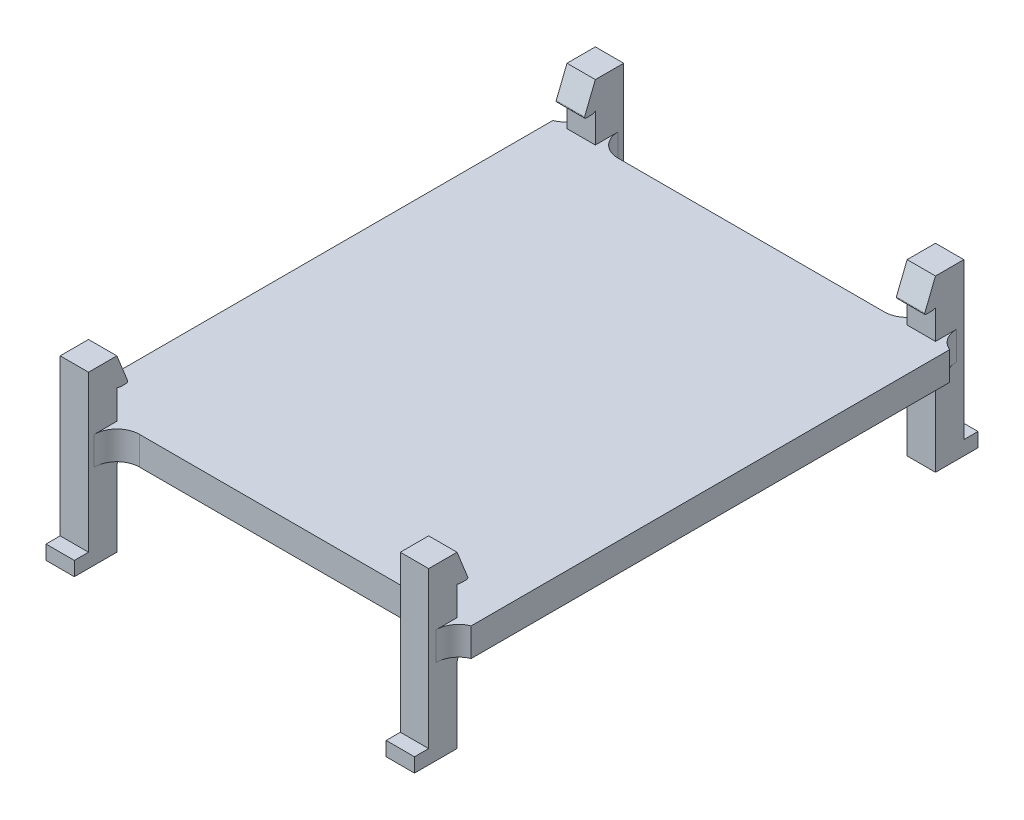
from build123d import *

# Parameters (mm, degrees)
SKETCH1_W           = 44.45
SKETCH1_H           = 53.594
BOSS_EXTRUDE1_DEPTH = 3.175
SKETCH2_W           = 3.175
SKETCH2_H           = 19.05
BOSS_EXTRUDE2_DEPTH = 3.175
SKETCH4_W           = 3.175
SKETCH4_H           = 19.05
BOSS_EXTRUDE3_DEPTH = 3.175
BOSS_EXTRUDE4_DEPTH = 3.175
BOSS_EXTRUDE5_DEPTH = 3.175
SKETCH11_W          = 3.175
SKETCH11_H          = 1.5875
BOSS_EXTRUDE6_DEPTH = 1.5875
SKETCH12_W          = 3.175
SKETCH12_H          = 1.5875
BOSS_EXTRUDE7_DEPTH = 1.5875
FILLET1_R           = 2.54
FILLET2_R           = 0.127
FILLET3_R           = 1.27


with BuildPart() as part:
    # Sketch1 → Boss-Extrude1 (new body)
    with BuildSketch(Plane(origin=(0, 0, 0), x_dir=(1, 0, 0), z_dir=(0, 1, 0))):
        with Locations((20.14322973, 10.682587838)):
            Rectangle(SKETCH1_W, SKETCH1_H)
    extrude(amount=BOSS_EXTRUDE1_DEPTH)

    # Sketch2 → Boss-Extrude2 (add)
    with BuildSketch(Plane.XY.offset(16.114412162)):
        with Locations((1.09322973, 0)):
            Rectangle(SKETCH2_W, SKETCH2_H)
        with Locations((39.19322973, 0)):
            Rectangle(SKETCH2_W, SKETCH2_H)
    extrude(amount=BOSS_EXTRUDE2_DEPTH)

    # Sketch4 → Boss-Extrude3 (add)
    with BuildSketch(Plane(origin=(0, 0, -37.479587838), x_dir=(-1, 0, 0), z_dir=(0, 0, -1))):
        with Locations((-1.09322973, 0)):
            Rectangle(SKETCH4_W, SKETCH4_H)
        with Locations((-39.19322973, 0)):
            Rectangle(SKETCH4_W, SKETCH4_H)
    extrude(amount=BOSS_EXTRUDE3_DEPTH)

    # Sketch9 → Boss-Extrude4 (add)
    with BuildSketch(Plane(origin=(40.78072973, 0, 0), x_dir=(0, 0, -1), z_dir=(1, 0, 0))):
        with BuildLine():
            Line((-16.114412162, 9.525), (-14.844412162, 6.35))
            add(Edge.make_bspline(
                [(-14.844412162, 6.35), (-15.980974803, 6.259875381), (-16.114412162, 6.477)],
                knots=[0, 0, 0, 1, 1, 1], degree=2))
            Line((-16.114412162, 6.477), (-16.114412162, 9.525))
        make_face()
        with BuildLine():
            Line((37.479587838, 9.525), (36.209587838, 6.35))
            add(Edge.make_bspline(
                [(36.209587838, 6.35), (37.346150478, 6.259875381), (37.479587838, 6.477)],
                knots=[0, 0, 0, 1, 1, 1], degree=2))
            Line((37.479587838, 6.477), (37.479587838, 9.525))
        make_face()
    extrude(amount=-BOSS_EXTRUDE4_DEPTH)

    # Sketch10 → Boss-Extrude5 (add)
    with BuildSketch(Plane.ZY.offset(0.49427027)):
        with BuildLine():
            Line((-37.479587838, 9.525), (-36.209587838, 6.35))
            add(Edge.make_bspline(
                [(-36.209587838, 6.35), (-37.253478126, 6.221904512), (-37.479587838, 6.477)],
                knots=[0, 0, 0, 1, 1, 1], degree=2))
            Line((-37.479587838, 6.477), (-37.479587838, 9.525))
        make_face()
        with BuildLine():
            Line((16.114412162, 9.525), (14.844412162, 6.35))
            add(Edge.make_bspline(
                [(14.844412162, 6.35), (15.88830245, 6.221904512), (16.114412162, 6.477)],
                knots=[0, 0, 0, 1, 1, 1], degree=2))
            Line((16.114412162, 6.477), (16.114412162, 9.525))
        make_face()
    extrude(amount=-BOSS_EXTRUDE5_DEPTH)

    # Sketch11 → Boss-Extrude6 (add)
    with BuildSketch(Plane.XY.offset(19.289412162)):
        with Locations((1.09322973, -8.73125)):
            Rectangle(SKETCH11_W, SKETCH11_H)
        with Locations((39.19322973, -8.73125)):
            Rectangle(SKETCH11_W, SKETCH11_H)
    extrude(amount=BOSS_EXTRUDE6_DEPTH)

    # Sketch12 → Boss-Extrude7 (add)
    with BuildSketch(Plane(origin=(0, 0, -40.654587838), x_dir=(-1, 0, 0), z_dir=(0, 0, -1))):
        with Locations((-39.19322973, -8.73125)):
            Rectangle(SKETCH12_W, SKETCH12_H)
        with Locations((-1.09322973, -8.73125)):
            Rectangle(SKETCH12_W, SKETCH12_H)
    extrude(amount=BOSS_EXTRUDE7_DEPTH)

    # Fillet1
    # the kernel refuses this fillet: 2.54 mm, written as the material it adds along each edge
    with BuildSketch(Plane(origin=(37.60572973, 0, 16.114412162), x_dir=(0, 0, 1), z_dir=(0, 1, 0)), Plane(origin=(2.68072973, 0, -37.479587838), x_dir=(0, 0, -1), z_dir=(0, 1, 0))) as fillet1_piece_1:
        with BuildLine():
            CenterArc((FILLET1_R, -FILLET1_R), FILLET1_R, 90, 90)
            Line((0, -FILLET1_R), (0, 0))
            Line((0, 0), (FILLET1_R, 0))
        make_face()
    extrude(amount=3.175)
    with BuildSketch(Plane(origin=(40.78072973, 3.175, 16.114412162), x_dir=(1, 0, 0), z_dir=(0, -1, 0)), Plane(origin=(-0.49427027, 0, 16.114412162), x_dir=(-1, 0, 0), z_dir=(0, 1, 0)), Plane(origin=(-0.49427027, 3.175, -37.479587838), x_dir=(-1, 0, 0), z_dir=(0, -1, 0))) as fillet1_piece_2:
        with BuildLine():
            CenterArc((2.54, 2.35464302), FILLET1_R, 180, 67.975687163)
            Line((0, 2.35464302), (0, 0))
            Line((0, 0), (1.5875, 0))
        make_face()
    extrude(amount=3.175)
    with BuildSketch(Plane(origin=(2.68072973, 3.175, 16.114412162), x_dir=(1, 0, 0), z_dir=(0, -1, 0)), Plane(origin=(37.60572973, 3.175, -37.479587838), x_dir=(-1, 0, 0), z_dir=(0, -1, 0))) as fillet1_piece_3:
        with BuildLine():
            CenterArc((FILLET1_R, FILLET1_R), FILLET1_R, 180, 90)
            Line((0, FILLET1_R), (0, 0))
            Line((0, 0), (FILLET1_R, 0))
        make_face()
    extrude(amount=3.175)
    with BuildSketch(Plane(origin=(40.78072973, 0, -37.479587838), x_dir=(0, 0, -1), z_dir=(0, 1, 0))) as fillet1_piece_4:
        with BuildLine():
            CenterArc((2.35464302, -2.54), FILLET1_R, 90, 67.975687163)
            Line((0, -1.5875), (0, 0))
            Line((0, 0), (2.35464302, 0))
        make_face()
    extrude(amount=3.175)

    # Fillet2
    fillet2_edges = [part.edges().sort_by_distance(p)[0] for p in [
        (39.19322973, 6.35, 14.844412162),
        (39.19322973, 6.35, -36.209587838),
        (1.09322973, 6.35, -36.209587838),
        (1.09322973, 6.35, 14.844412162),
    ]]
    fillet(fillet2_edges, radius=FILLET2_R)

    # Fillet3
    fillet3_edges = [part.edges().sort_by_distance(p)[0] for p in [
        (1.09322973, 0, 16.114412162),
        (39.19322973, 0, 16.114412162),
        (39.19322973, 0, -37.479587838),
        (1.09322973, 0, -37.479587838),
    ]]
    fillet(fillet3_edges, radius=FILLET3_R)


solid = part.part
